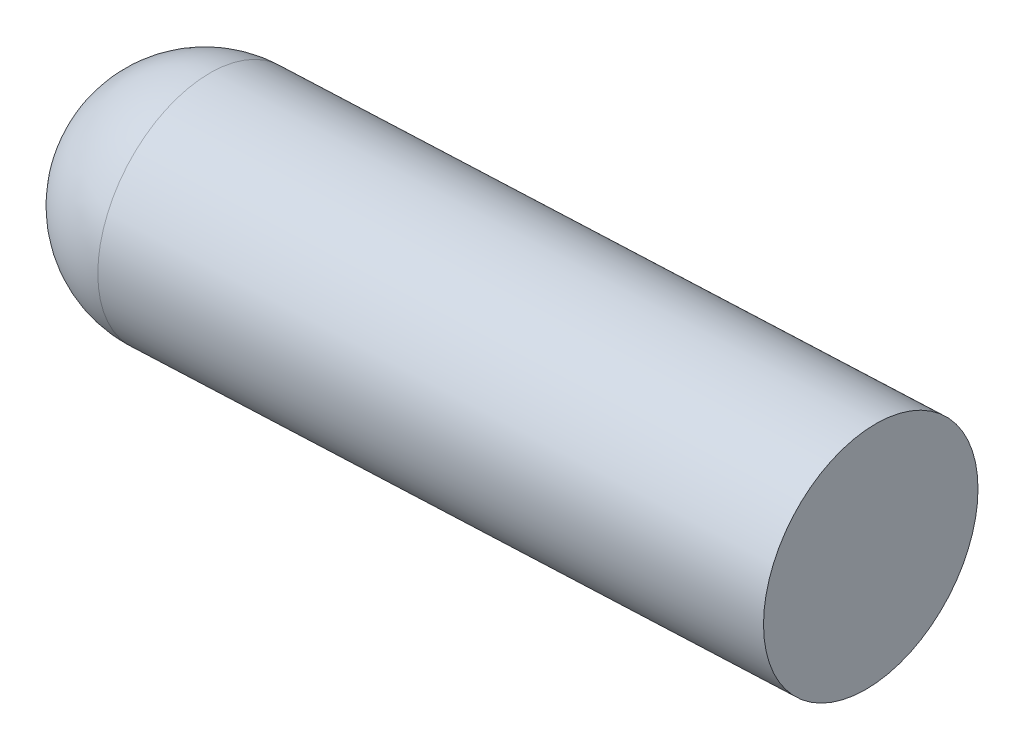
from build123d import *

# Parameters (mm, degrees)
SKETCH1_R           = 15
BOSS_EXTRUDE1_DEPTH = 100
FILLET1_R           = 15


# Read off the part's stored shape, not the designer's step: Bill Native-28-surface1
with BuildPart() as part:
    # Sketch1 → Boss-Extrude1 (new body)
    with BuildSketch(Plane(origin=(87.322284579, 0, -3.975399354), x_dir=(0.04547849496662145, 0, 0.9989653179643281), z_dir=(-0.9989653179643281, 0, 0.04547849496662145))):
        with Locations((-66.108493759, -228.751608372)):
            Circle(SKETCH1_R)
    extrude(amount=BOSS_EXTRUDE1_DEPTH)

    # Fillet1
    fillet1_edges = [part.edges().sort_by_distance(p)[0] for p in [
        (-16.262939442, -228.751608372, -80.452122115),
    ]]
    fillet(fillet1_edges, radius=FILLET1_R)


solid = part.part
